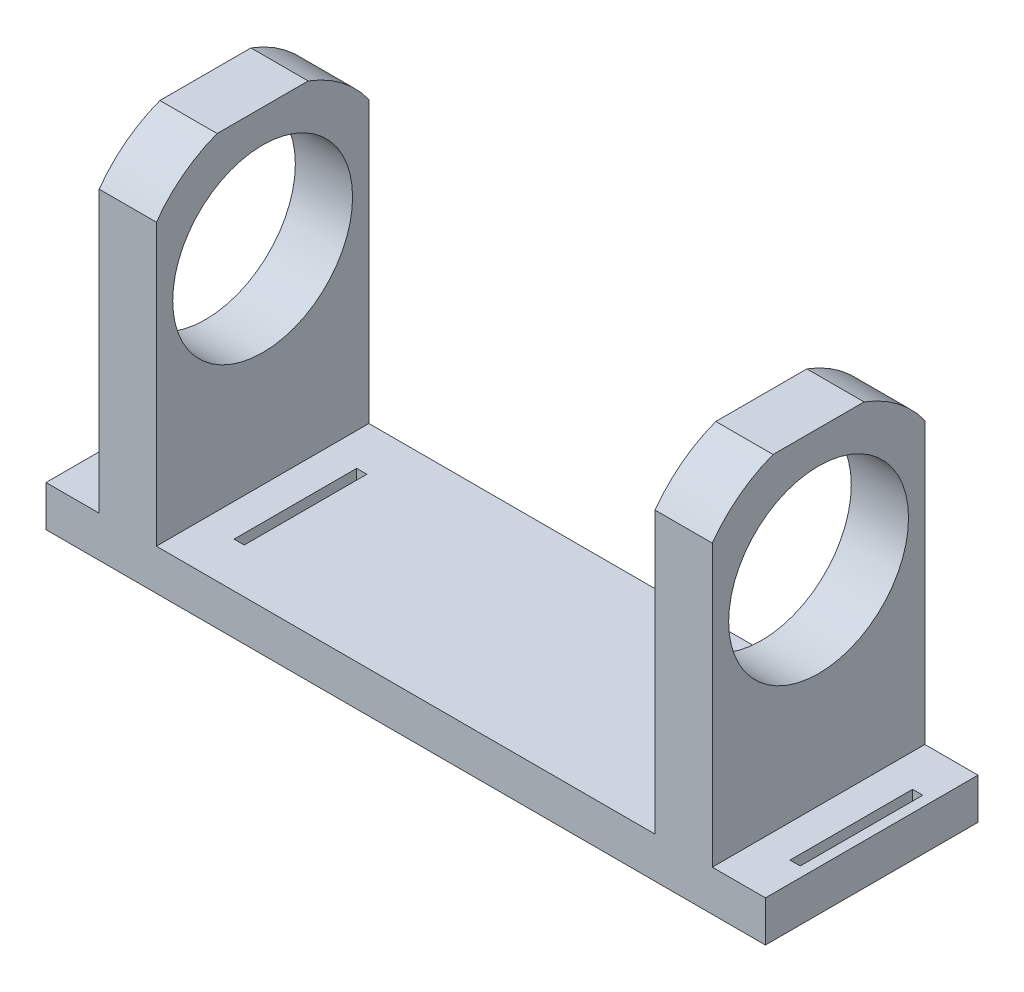
from build123d import *

# Parameters (mm, degrees)
SKETCH1_W           = 20
SKETCH1_H           = 26
SKETCH1_W_2         = 1.25
SKETCH1_H_2         = 15
BOSS_EXTRUDE5_DEPTH = 5
SKETCH3_W           = 7
SKETCH3_H           = 26
BOSS_EXTRUDE6_DEPTH = 40
CUT_EXTRUDE1_REACH  = 55.696
SKETCH5_R           = 11
SKETCH6_W           = 26
SKETCH6_H           = 5
BOSS_EXTRUDE8_DEPTH = 24


with BuildPart() as part:
    # Sketch1 → Boss-Extrude5 (new body)
    with BuildSketch(Plane(origin=(0, 0, 0), x_dir=(1, 0, 0), z_dir=(0, 1, 0))):
        with Locations((10, 13)):
            Rectangle(SKETCH1_W, SKETCH1_H)
        with Locations((1.875, 13)):
            Rectangle(SKETCH1_W_2, SKETCH1_H_2, mode=Mode.SUBTRACT)
        with Locations((18.125784532, 13)):
            Rectangle(SKETCH1_W_2, SKETCH1_H_2, mode=Mode.SUBTRACT)
    boss_extrude5 = extrude(amount=BOSS_EXTRUDE5_DEPTH)

    # Sketch3 → Boss-Extrude6 (add)
    with BuildSketch(Plane(origin=(0, 5, 0), x_dir=(1, 0, 0), z_dir=(0, 1, 0))):
        with Locations((10, 13)):
            Rectangle(SKETCH3_W, SKETCH3_H)
    boss_extrude6 = extrude(amount=BOSS_EXTRUDE6_DEPTH)

    # Sketch5 → Cut-Extrude1 (cut, up to next)
    with BuildSketch(Plane(origin=(13.5, 0, 0), x_dir=(0, 0, -1), z_dir=(1, 0, 0)), mode=Mode.PRIVATE) as cut_extrude1_sk1:
        with Locations((13, 30)):
            Circle(SKETCH5_R)
    cut_extrude1_tool1 = extrude(cut_extrude1_sk1.sketch, amount=-CUT_EXTRUDE1_REACH, mode=Mode.PRIVATE) & part.part
    # Sketch5 → Cut-Extrude1 (cut, up to next)
    with BuildSketch(Plane(origin=(13.5, 0, 0), x_dir=(0, 0, -1), z_dir=(1, 0, 0)), mode=Mode.PRIVATE) as cut_extrude1_sk2:
        with BuildLine():
            Line((7.432235637, 45), (0, 45))
            Line((0, 45), (0, 39.327379053))
            ThreePointArc((0, 39.327379053), (3.292522189, 42.718682107), (7.432235637, 45))
        make_face()
    cut_extrude1_tool2 = extrude(cut_extrude1_sk2.sketch, amount=-CUT_EXTRUDE1_REACH, mode=Mode.PRIVATE) & part.part
    # Sketch5 → Cut-Extrude1 (cut, up to next)
    with BuildSketch(Plane(origin=(13.5, 0, 0), x_dir=(0, 0, -1), z_dir=(1, 0, 0)), mode=Mode.PRIVATE) as cut_extrude1_sk3:
        with BuildLine():
            Line((26, 39.327379053), (26, 45))
            Line((26, 45), (18.567764363, 45))
            ThreePointArc((18.567764363, 45), (22.707477811, 42.718682107), (26, 39.327379053))
        make_face()
    cut_extrude1_tool3 = extrude(cut_extrude1_sk3.sketch, amount=-CUT_EXTRUDE1_REACH, mode=Mode.PRIVATE) & part.part
    cut_extrude1_1 = cut_extrude1_tool1.solids().sort_by_distance((13.5, 30, -13))[0]
    add(cut_extrude1_1, mode=Mode.SUBTRACT)
    cut_extrude1_2 = cut_extrude1_tool2.solids().sort_by_distance((13.5, 43.298273, -2.197768))[0]
    add(cut_extrude1_2, mode=Mode.SUBTRACT)
    cut_extrude1_3 = cut_extrude1_tool3.solids().sort_by_distance((13.5, 43.298273, -23.802232))[0]
    add(cut_extrude1_3, mode=Mode.SUBTRACT)
    cut_extrude1 = cut_extrude1_1 + cut_extrude1_2 + cut_extrude1_3  # Cut-Extrude1 as one shape, for the pattern or mirror that repeats it

    # Sketch6 → Boss-Extrude8 (add)
    with BuildSketch(Plane(origin=(20, 0, 0), x_dir=(0, 0, -1), z_dir=(1, 0, 0))):
        with Locations((13, 2.5)):
            Rectangle(SKETCH6_W, SKETCH6_H)
    boss_extrude8 = extrude(amount=BOSS_EXTRUDE8_DEPTH)

    # Mirror5: Boss-Extrude5, Boss-Extrude6, Cut-Extrude1, Boss-Extrude8 across plane
    add(boss_extrude5.mirror(Plane.ZY.offset(-44)))
    add(boss_extrude6.mirror(Plane.ZY.offset(-44)))
    add(cut_extrude1.mirror(Plane.ZY.offset(-44)), mode=Mode.SUBTRACT)
    add(boss_extrude8.mirror(Plane.ZY.offset(-44)))


solid = part.part
